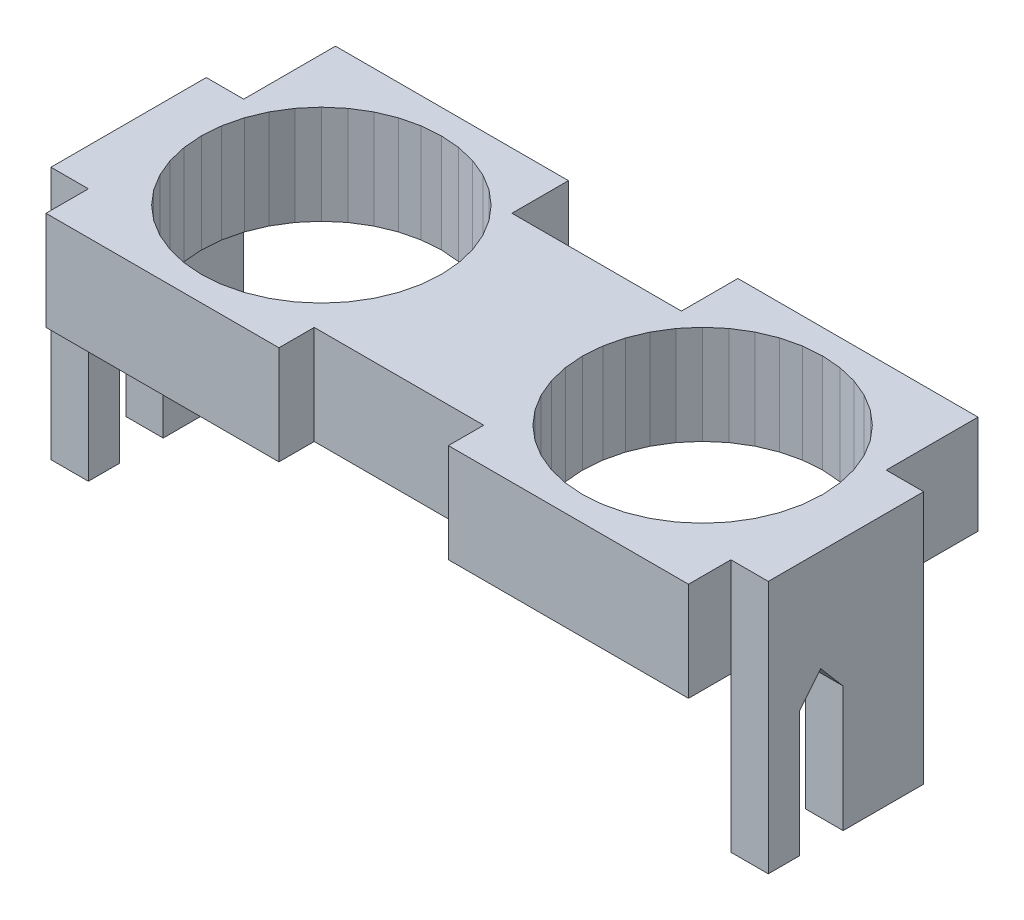
from build123d import *

# Parameters (mm, degrees)
CONVERTED1_START         = 177.799999714
CONVERTED1_DEPTH         = 177.799999714
CONVERTED1_2_OUTLINE_W   = 67.310094833
CONVERTED1_2_OUTLINE_H   = 144.784152508
CONVERTED1_2_OUTLINE_H_2 = 55.875837803
CONVERTED1_2_OUTLINE_W_2 = 67.310005426
CONVERTED1_2_DEPTH       = 177.799999714
CONVERTED1_START_2       = 125.335559249
CONVERTED1_3_OUTLINE_W   = 67.310094833
CONVERTED1_3_OUTLINE_H   = 78.740000725
CONVERTED1_3_OUTLINE_W_2 = 67.310005426
CONVERTED1_3_DEPTH       = 52.464440465
CONVERTED1_START_3       = -1
CONVERTED1_4_DEPTH       = 1292
SKETCH1_W                = 67.310005426
SKETCH1_H                = 144.784152508
SKETCH1_H_2              = 55.875837803
SKETCH1_W_2              = 67.310094833
BOSS_EXTRUDE1_DEPTH      = 100


with BuildPart() as part:
    # Converted1: read off the stored shape, not the designer's step
    # Converted1 outline → Converted1 (new body)
    with BuildSketch(Plane(origin=(0, 0, 0), x_dir=(1, 0, 0), z_dir=(0, 1, 0)).offset(CONVERTED1_START)):
        Polygon((1223.009943962, -165.100008249), (1223.009943962, 0), (791.113138199, 0), (791.113138199, -101.599998772), (486.313134432, -101.599998772), (486.313134432, 0), (67.310005426, 0), (67.310005426, -165.100008249), (0, -165.100008249), (0, -444.499999285), (67.310005426, -444.499999285), (67.310005426, -520.699977875), (486.313134432, -520.699977875), (486.313134432, -457.199990749), (791.113138199, -457.199990749), (791.113138199, -520.699977875), (1223.009943962, -520.699977875), (1223.009943962, -444.499999285), (1290.320038795, -444.499999285), (1290.320038795, -165.100008249), align=None)
        Polygon((515.501916409, -226.575806737), (518.159985542, -260.349988937), (515.501916409, -294.124186039), (507.593095303, -327.066779137), (494.628280401, -358.366549015), (476.926743984, -387.25283742), (454.924374819, -413.014382124), (429.162800312, -435.016751289), (400.27654171, -452.718287706), (368.976742029, -465.683102608), (336.034178734, -473.591923714), (302.259981632, -476.249992847), (268.485784531, -473.591923714), (235.543236136, -465.683102608), (204.243451357, -452.718287706), (175.357162952, -435.016751289), (149.59564805, -413.014382124), (127.593204379, -387.25283742), (109.891682863, -358.366549015), (96.926905215, -327.066779137), (89.018076658, -294.124186039), (86.360000074, -260.349988937), (89.018076658, -226.575806737), (96.926905215, -193.633243442), (109.891682863, -162.333458662), (127.593204379, -133.447170258), (149.59564805, -107.685647905), (175.357162952, -85.683234036), (204.243451357, -67.98170507), (235.543236136, -55.016901344), (268.485784531, -47.108106315), (302.259981632, -44.449992478), (336.034178734, -47.108106315), (368.976742029, -55.016901344), (400.27654171, -67.98170507), (429.162800312, -85.683234036), (454.924374819, -107.685647905), (476.926743984, -133.447170258), (494.628280401, -162.333458662), (507.593095303, -193.633243442), align=None, mode=Mode.SUBTRACT)
        Polygon((1054.776668549, -55.016901344), (1086.076498032, -67.98170507), (1114.962816238, -85.683234036), (1140.724420547, -107.685647905), (1162.726759911, -133.447170258), (1180.428385735, -162.333458662), (1193.39299202, -193.633243442), (1201.301813126, -226.575806737), (1203.959941864, -260.349988937), (1201.301813126, -294.124186039), (1193.39299202, -327.066779137), (1180.428385735, -358.366549015), (1162.726759911, -387.25283742), (1140.724420547, -413.014382124), (1114.962816238, -435.016751289), (1086.076498032, -452.718287706), (1054.776668549, -465.683102608), (1021.834254265, -473.591923714), (988.060057163, -476.249992847), (954.285860062, -473.591923714), (921.343266964, -465.683102608), (890.043437481, -452.718287706), (861.157119274, -435.016751289), (835.395634174, -413.014382124), (813.393175602, -387.25283742), (795.691668987, -358.366549015), (782.726883888, -327.066779137), (774.818062782, -294.124186039), (772.159993649, -260.349988937), (774.818062782, -226.575806737), (782.726883888, -193.633243442), (795.691668987, -162.333458662), (813.393175602, -133.447170258), (835.395634174, -107.685647905), (861.157119274, -85.683234036), (890.043437481, -67.98170507), (921.343266964, -55.016901344), (954.285860062, -47.108106315), (988.060057163, -44.449992478), (1021.834254265, -47.108106315), align=None, mode=Mode.SUBTRACT)
    extrude(amount=CONVERTED1_DEPTH)



with BuildPart() as body_2:
    # Converted1 2 outline → Converted1 2 (new body)
    with BuildSketch(Plane(origin=(0, 0, 0), x_dir=(1, 0, 0), z_dir=(0, 1, 0))):
        with Locations((1256.664991378, -237.492084503)):
            Rectangle(CONVERTED1_2_OUTLINE_W, CONVERTED1_2_OUTLINE_H)
        with Locations((1256.664991378, -416.562080384)):
            Rectangle(CONVERTED1_2_OUTLINE_W, CONVERTED1_2_OUTLINE_H_2)
        with Locations((33.655002713, -237.492084503)):
            Rectangle(CONVERTED1_2_OUTLINE_W_2, CONVERTED1_2_OUTLINE_H)
        with Locations((33.655002713, -416.562080384)):
            Rectangle(CONVERTED1_2_OUTLINE_W_2, CONVERTED1_2_OUTLINE_H_2)
    extrude(amount=CONVERTED1_2_DEPTH)


with BuildPart() as part_1:
    add(part.part)

    add(body_2.part)  # Converted1 3 merges body 2
    # Converted1 3 outline → Converted1 3 (add)
    with BuildSketch(Plane(origin=(0, 0, 0), x_dir=(1, 0, 0), z_dir=(0, 1, 0)).offset(CONVERTED1_START_2)):
        with Locations((1256.664991378, -349.25416112)):
            Rectangle(CONVERTED1_3_OUTLINE_W, CONVERTED1_3_OUTLINE_H)
        with Locations((33.655002713, -349.25416112)):
            Rectangle(CONVERTED1_3_OUTLINE_W_2, CONVERTED1_3_OUTLINE_H)
    extrude(amount=CONVERTED1_3_DEPTH)

    # Converted1 4 outline → Converted1 4 (cut)
    with BuildSketch(Plane.YZ.offset(CONVERTED1_START_3)):
        Polygon((125.335559249, 388.624161482), (125.335559249, 309.884160757), (172.469392419, 350.206673145), align=None)
    extrude(amount=CONVERTED1_4_DEPTH, mode=Mode.SUBTRACT)

    # Sketch1 → Boss-Extrude1 (add)
    with BuildSketch(Plane.XZ):
        with Locations((33.655002713, 237.492084503)):
            Rectangle(SKETCH1_W, SKETCH1_H)
        with Locations((33.655002713, 416.562080384)):
            Rectangle(SKETCH1_W, SKETCH1_H_2)
        with Locations((1256.664991378, 416.562080384)):
            Rectangle(SKETCH1_W_2, SKETCH1_H_2)
        with Locations((1256.664991378, 237.492084503)):
            Rectangle(SKETCH1_W_2, SKETCH1_H)
    extrude(amount=BOSS_EXTRUDE1_DEPTH)


solid = part_1.part
